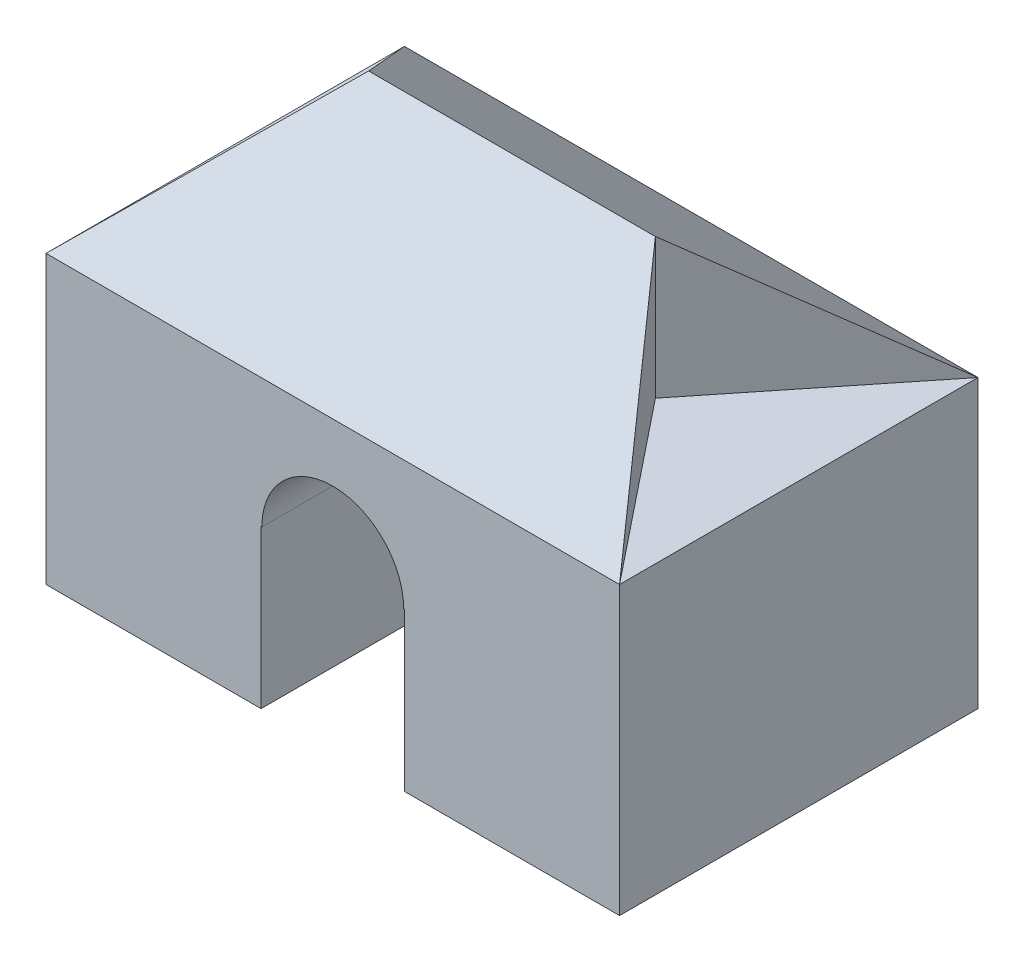
from build123d import *

# Parameters (mm, degrees)
CROQUIS1_W              = 400
CROQUIS1_H              = 250
SALIENTE_EXTRUIR1_DEPTH = 200
CORTAR_EXTRUIR1_DEPTH   = 115
SALIENTE_EXTRUIR2_DEPTH = 100
CHAFL_N1_SIZE           = 100
CHAFL_N1_SIZE2          = 127.994163219
CHAFL_N2_SIZE           = 127.994163219
CHAFL_N2_SIZE_2         = 100


with BuildPart() as part:
    # Croquis1 → Saliente-Extruir1 (new body)
    with BuildSketch(Plane(origin=(0, 0, 0), x_dir=(1, 0, 0), z_dir=(0, 1, 0))):
        Rectangle(CROQUIS1_W, CROQUIS1_H)
    extrude(amount=SALIENTE_EXTRUIR1_DEPTH)

    # Croquis2 → Cortar-Extruir1 (cut)
    with BuildSketch(Plane.XY.offset(125)):
        with BuildLine():
            Line((-50, 0), (50, 0))
            Line((50, 0), (50, 109.989754524))
            Line((50, 109.989754524), (49.464803301, 109.989754524))
            ThreePointArc((49.464803301, 109.989754524), (0, 159.454557825), (-49.464803301, 109.989754524))
            Line((-49.464803301, 109.989754524), (-50, 109.989754524))
            Line((-50, 109.989754524), (-50, 0))
        make_face()
    extrude(amount=-CORTAR_EXTRUIR1_DEPTH, mode=Mode.SUBTRACT)

    # Croquis4 → Saliente-Extruir2 (add)
    with BuildSketch(Plane(origin=(0, 200, 0), x_dir=(1, 0, 0), z_dir=(0, 1, 0))):
        Polygon((-200, 125), (-100, 0), (100, 0), (200, 125), align=None)
        Polygon((-100, 0), (100, 0), (200, -125), (-200, -125), align=None)
    extrude(amount=SALIENTE_EXTRUIR2_DEPTH)

    # Chaflán1
    chafl_n1_edges = [part.edges().sort_by_distance(p)[0] for p in [
        (0, 300, 125),
    ]]
    chafl_n1_side = [part.faces().sort_by_distance(p)[0] for p in [
        (0, 160.632106787, 125),
    ]]
    chamfer(chafl_n1_edges, length=CHAFL_N1_SIZE, length2=CHAFL_N1_SIZE2, reference=chafl_n1_side[0])

    # Chaflán2
    # the kernel refuses this chamfer: 127.994163219, 100 mm, written as the material it takes off along each edge
    with BuildSketch(Plane(origin=(530.165536966, 300, -125), x_dir=(0, 0.023867141339117125, 0.9997151392093142), z_dir=(-1, 0, 0))) as chafl_n2_piece_1:
        Polygon((CHAFL_N2_SIZE * 0.999715139212, -CHAFL_N2_SIZE * 0.0238671413392), (-CHAFL_N2_SIZE_2 * 0.0238671413391, -CHAFL_N2_SIZE_2 * 0.999715139209), (0, 0), align=None)
    extrude(amount=1060.331073932, mode=Mode.SUBTRACT)


solid = part.part
